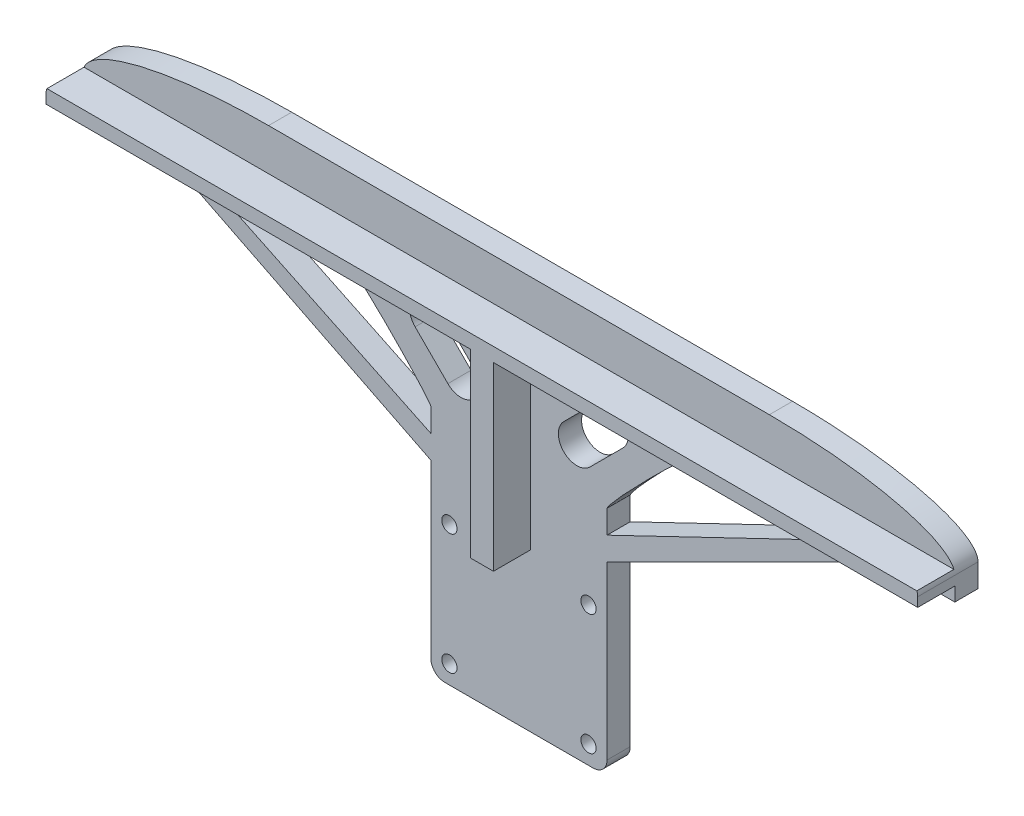
from build123d import *

# Parameters (mm, degrees)
SKETCH1_W           = 38
SKETCH1_H           = 70
BOSS_EXTRUDE1_DEPTH = 5
SKETCH2_R           = 1.65
CUT_EXTRUDE1_DEPTH  = 134.018795664
FILLET1_R           = 3
FILLET2_DEPTH       = 5
SKETCH3_W           = 188
SKETCH3_H           = 3
BOSS_EXTRUDE2_DEPTH = 8
SKETCH4_W           = 5
SKETCH4_H           = 39
BOSS_EXTRUDE3_DEPTH = 8
BOSS_EXTRUDE4_DEPTH = 5
FILLET3_SIZE        = 40
FILLET3_SIZE_2      = 10
FILLET4_SIZE        = 40
FILLET4_SIZE_2      = 10
CUT_EXTRUDE2_DEPTH  = 134.165310942


with BuildPart() as part:
    # Sketch1 → Boss-Extrude1 (new body)
    with BuildSketch(Plane.XY):
        with Locations((19, -35)):
            Rectangle(SKETCH1_W, SKETCH1_H)
        Polygon((-75, 15), (-75, 0), (0, 0), (38, 0), (113, 0), (113, 15), align=None)
    extrude(amount=BOSS_EXTRUDE1_DEPTH)

    # Sketch2 → Cut-Extrude1 (cut, through all)
    with BuildSketch(Plane.XY.offset(5)):
        with Locations((34, -66)):
            Circle(SKETCH2_R)
        with Locations((4, -66)):
            Circle(SKETCH2_R)
        with Locations((4, -40)):
            Circle(SKETCH2_R)
        with Locations((34, -40)):
            Circle(SKETCH2_R)
    extrude(amount=-CUT_EXTRUDE1_DEPTH, mode=Mode.SUBTRACT)

    # Fillet1
    fillet1_edges = [part.edges().sort_by_distance(p)[0] for p in [
        (38, -70, 2.5),
        (0, -70, 2.5),
    ]]
    fillet(fillet1_edges, radius=FILLET1_R)

    # Fillet2: read off the stored shape, not the designer's step
    # Fillet2 outline → Fillet2 (add)
    with BuildSketch(Plane.XY):
        with BuildLine():
            add(Edge.make_bspline(
                [(58, 0), (38, 0), (38, -20)],
                knots=[0, 0, 0, 1, 1, 1], degree=2, weights=[1, 0.052631579, 1]))
            Line((58, 0), (38, 0))
            Line((38, 0), (38, -20))
        make_face()
        with BuildLine():
            Line((0, 0), (-20, 0))
            add(Edge.make_bspline(
                [(-20, 0), (0, 0), (0, -20)],
                knots=[0, 0, 0, 1, 1, 1], degree=2, weights=[1, 0.052631579, 1]))
            Line((0, -20), (0, 0))
        make_face()
    extrude(amount=FILLET2_DEPTH)

    # Sketch3 → Boss-Extrude2 (add)
    with BuildSketch(Plane.XY.offset(5)):
        with Locations((19, 4.5)):
            Rectangle(SKETCH3_W, SKETCH3_H)
    extrude(amount=BOSS_EXTRUDE2_DEPTH)

    # Sketch4 → Boss-Extrude3 (add)
    with BuildSketch(Plane.XY.offset(5)):
        with Locations((19, -16.5)):
            Rectangle(SKETCH4_W, SKETCH4_H)
    extrude(amount=BOSS_EXTRUDE3_DEPTH)

    # Sketch5 → Boss-Extrude4 (add)
    with BuildSketch(Plane.XY.offset(5)):
        Polygon((-52, 0), (-57.902965871, 0), (-60, 0), (0, -30), (0, -25), align=None)
        Polygon((38, -30), (98, 0), (90, 0), (38, -25), align=None)
    extrude(amount=-BOSS_EXTRUDE4_DEPTH)

    # Fillet3
    # a fillet whose section is not a circle: 40, 10 mm, written as the material it takes off along each edge
    with BuildSketch(Plane(origin=(-75, 15, -100), x_dir=(1, 0, 0), z_dir=(0, 0, 1))) as fillet3_piece_1:
        with BuildLine():
            Bezier((FILLET3_SIZE, 0), (0, 0), (0, -FILLET3_SIZE_2), weights=[1, 0.707106781, 1])
            Line((0, -FILLET3_SIZE_2), (0, 0))
            Line((0, 0), (FILLET3_SIZE, 0))
        make_face()
    extrude(amount=205, mode=Mode.SUBTRACT)

    # Fillet4
    # a fillet whose section is not a circle: 40, 10 mm, written as the material it takes off along each edge
    with BuildSketch(Plane(origin=(113, 15, -100), x_dir=(-1, 0, 0), z_dir=(0, 0, 1))) as fillet4_piece_1:
        with BuildLine():
            Bezier((FILLET4_SIZE, 0), (0, 0), (0, FILLET4_SIZE_2), weights=[1, 0.707106781, 1])
            Line((0, FILLET4_SIZE_2), (0, 0))
            Line((0, 0), (FILLET4_SIZE, 0))
        make_face()
    extrude(amount=205, mode=Mode.SUBTRACT)

    # Sketch6 → Cut-Extrude2 (cut, through all)
    with BuildSketch(Plane.XY.offset(5)):
        with BuildLine():
            Line((3.671572875, -13.862410437), (-3.399494937, -6.791342626))
            ThreePointArc((-3.399494937, -6.791342626), (-3.399494937, -1.134488376), (2.257359313, -1.134488376))
            Line((2.257359313, -1.134488376), (9.328427125, -8.205556188))
            ThreePointArc((9.328427125, -8.205556188), (9.328427125, -13.862410437), (3.671572875, -13.862410437))
        make_face()
        with BuildLine():
            Line((28.671572875, -8.445013015), (35.742640687, -1.373945203))
            ThreePointArc((35.742640687, -1.373945203), (41.399494937, -1.373945203), (41.399494937, -7.030799453))
            Line((41.399494937, -7.030799453), (34.328427125, -14.101867265))
            ThreePointArc((34.328427125, -14.101867265), (28.671572875, -14.101867265), (28.671572875, -8.445013015))
        make_face()
    extrude(amount=-CUT_EXTRUDE2_DEPTH, mode=Mode.SUBTRACT)


solid = part.part
